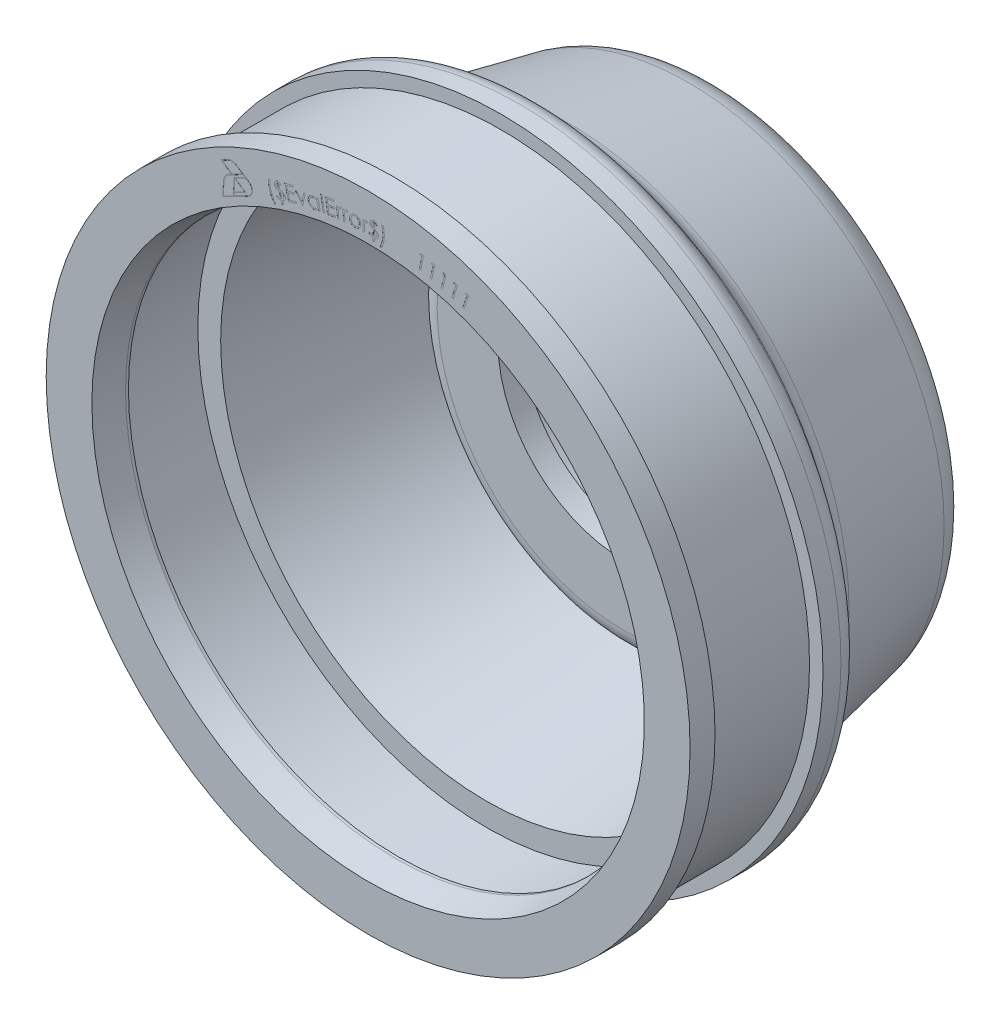
from build123d import *

# Parameters (mm, degrees)
CUT_EXTRUDE1_START = -0.01
CUT_EXTRUDE1_DEPTH = 0.01


# Read off the part's stored shape, not the designer's step: Cut-Extrude1
with BuildPart() as part:
    # Sketch1 → Revolve1 (revolve)
    with BuildSketch(Plane(origin=(0, 0, 0), x_dir=(0, 0, -1), z_dir=(1, 0, 0)), mode=Mode.PRIVATE) as revolve1_sk:
        with BuildLine():
            Line((0, 30.25), (0, 51.84306193))
            ThreePointArc((0, 51.84306193), (-2.250986696, 58.163884092), (-7.990558563, 61.639088936))
            Line((-7.990558563, 61.639088936), (-36.787849556, 67.54622555))
            ThreePointArc((-36.787849556, 67.54622555), (-38.780943256, 68.347628238), (-40.364003311, 69.799726591))
            Line((-40.364003311, 69.799726591), (-44.699441155, 75.520095969))
            ThreePointArc((-44.699441155, 75.520095969), (-46.459484376, 76.977749426), (-48.684290003, 77.5))
            Line((-48.684290003, 77.5), (-53, 77.5))
            Line((-53, 77.5), (-53, 74.25))
            Line((-53, 74.25), (-79, 74.25))
            Line((-79, 74.25), (-79, 77.5))
            Line((-79, 77.5), (-85, 77.5))
            Line((-85, 77.5), (-85, 66.5))
            Line((-85, 66.5), (-78.4, 65))
            Line((-78.4, 65), (-77.7, 65))
            Line((-77.7, 65), (-77.7, 69.5))
            Line((-77.7, 69.5), (-56.5, 69.5))
            Line((-56.5, 69.5), (-56.5, 64))
            Line((-56.5, 64), (-11.652067248, 57.697034096))
            ThreePointArc((-11.652067248, 57.697034096), (-10.113226049, 56.861511497), (-9.5, 55.221363924))
            Line((-9.5, 55.221363924), (-9.5, 54.006983458))
            ThreePointArc((-9.5, 54.006983458), (-10.050487257, 52.441927527), (-11.459520052, 51.566106274))
            Line((-11.459520052, 51.566106274), (-19.580959896, 49.767787452))
            ThreePointArc((-19.580959896, 49.767787452), (-22.399025486, 48.016144945), (-23.5, 44.886033084))
            Line((-23.5, 44.886033084), (-23.5, 30.25))
            Line((-23.5, 30.25), (-18, 30.25))
            Line((-18, 30.25), (-18, 37.65))
            ThreePointArc((-18, 37.65), (-17.912132034, 37.862132034), (-17.7, 37.95))
            Line((-17.7, 37.95), (-5.8, 37.95))
            ThreePointArc((-5.8, 37.95), (-5.587867966, 37.862132034), (-5.5, 37.65))
            Line((-5.5, 37.65), (-5.5, 30.25))
            Line((-5.5, 30.25), (0, 30.25))
        make_face()
    revolve(revolve1_sk.sketch.rotate(Axis((0, 0, 0), (0, 0, 1)), 90), axis=Axis((0, 0, 0), (0, 0, 1)))

    # Cut-Extrude1 outline → Cut-Extrude1 (cut)
    # profile 1 of 19: a face of its own
    with BuildSketch(Plane.XY.offset(85).offset(CUT_EXTRUDE1_START)):
        with BuildLine():
            add(Edge.make_bspline(
                [(-23.610921997, 65.482463356), (-23.646585557, 65.587061176), (-23.717480833, 65.794990259), (-23.804318716, 66.111448338), (-23.877281591, 66.428226101), (-23.93217108, 66.74545329), (-23.971585058, 67.059661744), (-23.994329579, 67.369011415), (-23.999947379, 67.671970761), (-23.990159236, 67.871444986), (-23.985321036, 67.970043484)],
                knots=[0, 0, 0, 0, 0.130878881, 0.260172971, 0.38851157, 0.515811978, 0.64135007, 0.763480574, 0.883090358, 1, 1, 1, 1], degree=3))
            add(Edge.make_bspline(
                [(-22.516470876, 63.552976177), (-22.567955957, 63.612414584), (-22.674116049, 63.734974104), (-22.823184373, 63.936953489), (-22.972124251, 64.157634656), (-23.116442262, 64.397880172), (-23.256537988, 64.65228781), (-23.384351951, 64.920186159), (-23.505909411, 65.196224544), (-23.575706384, 65.386474146), (-23.610921997, 65.482463356)],
                knots=[0, 0, 0, 0, 0.10569616, 0.217941078, 0.337254941, 0.463575966, 0.594637326, 0.727591538, 0.862558066, 1, 1, 1, 1], degree=3))
            Line((-22.516470876, 63.552976177), (-22.172220074, 63.674971369))
            add(Edge.make_bspline(
                [(-23.292612703, 65.643020247), (-23.256830908, 65.545906971), (-23.185936109, 65.353495547), (-23.064294309, 65.073009377), (-22.932925118, 64.802066194), (-22.791903737, 64.542486914), (-22.644495427, 64.29745215), (-22.491638026, 64.07115296), (-22.336455119, 63.863430896), (-22.226046215, 63.736736804), (-22.172220074, 63.674971369)],
                knots=[0, 0, 0, 0, 0.13626151, 0.269976179, 0.40238404, 0.532655648, 0.658849237, 0.778773484, 0.892148467, 1, 1, 1, 1], degree=3))
            add(Edge.make_bspline(
                [(-23.622841068, 68.099049895), (-23.627337339, 68.054437393), (-23.636435834, 67.964161132), (-23.644847596, 67.826652174), (-23.647827538, 67.685641105), (-23.648249083, 67.540920507), (-23.643267607, 67.392427527), (-23.632941409, 67.240300928), (-23.62003635, 67.084294208), (-23.595418613, 66.87120521), (-23.554364843, 66.602349767), (-23.485705566, 66.280660545), (-23.400310589, 65.959679752), (-23.328650304, 65.748980071), (-23.292612703, 65.643020247)],
                knots=[0, 0, 0, 0, 0.053847414, 0.108963702, 0.165397831, 0.223217908, 0.282754492, 0.343788676, 0.406327426, 0.470737215, 0.601378898, 0.732781804, 0.865617294, 1, 1, 1, 1], degree=3))
            Line((-23.622841068, 68.099049895), (-23.985321036, 67.970043484))
        make_face()
    # profile 2 of 19: a face of its own
    with BuildSketch(Plane.XY.offset(85).offset(CUT_EXTRUDE1_START)):
        with BuildLine():
            add(Edge.make_bspline(
                [(-21.684301012, 68.548223833), (-21.64625284, 68.552237072), (-21.57215586, 68.560052662), (-21.462901305, 68.559146188), (-21.359249167, 68.548211197), (-21.259403086, 68.526157597), (-21.161495749, 68.491365366), (-21.06178099, 68.445691949), (-20.961023894, 68.385429621), (-20.895205967, 68.338373125), (-20.861184024, 68.314049154)],
                knots=[0, 0, 0, 0, 0.130214002, 0.25358549, 0.371277994, 0.484630063, 0.600922819, 0.724499532, 0.857591061, 1, 1, 1, 1], degree=3))
            Line((-21.684301012, 68.548223833), (-21.762826653, 68.794317583))
            Line((-21.762826653, 68.794317583), (-22.05870005, 68.699666141))
            Line((-22.05870005, 68.699666141), (-21.98438114, 68.467594827))
            add(Edge.make_bspline(
                [(-22.557197646, 67.409602038), (-22.566596824, 67.443287588), (-22.585173599, 67.509864574), (-22.595673375, 67.612904921), (-22.593984948, 67.71615036), (-22.577268175, 67.818985992), (-22.549163736, 67.919841738), (-22.506955203, 68.015404387), (-22.454852042, 68.10651163), (-22.389605209, 68.191802254), (-22.311251802, 68.272122803), (-22.216241068, 68.344338477), (-22.106745299, 68.4111296), (-22.026169865, 68.448311322), (-21.98438114, 68.467594827)],
                knots=[0, 0, 0, 0, 0.078882619, 0.155905633, 0.233008232, 0.311566824, 0.390618893, 0.468891302, 0.546955082, 0.627211077, 0.710843528, 0.79966181, 0.896098885, 1, 1, 1, 1], degree=3))
            add(Edge.make_bspline(
                [(-21.96895646, 66.869037134), (-22.006165789, 66.881139456), (-22.07840412, 66.904634949), (-22.178710352, 66.951123161), (-22.268544699, 67.004568434), (-22.347081011, 67.066765566), (-22.415832288, 67.137821071), (-22.473133731, 67.219265077), (-22.521845566, 67.310077127), (-22.545197687, 67.375819164), (-22.557197646, 67.409602038)],
                knots=[0, 0, 0, 0, 0.140397712, 0.272568645, 0.39605397, 0.514927709, 0.631259345, 0.749788968, 0.871424006, 1, 1, 1, 1], degree=3))
            add(Edge.make_bspline(
                [(-21.444517358, 66.775086814), (-21.477006931, 66.779965376), (-21.539209869, 66.78930563), (-21.627828588, 66.803081682), (-21.707199088, 66.81671608), (-21.777402685, 66.828351152), (-21.838400537, 66.839600795), (-21.890124965, 66.849830089), (-21.932572584, 66.859852766), (-21.957745044, 66.866207041), (-21.96895646, 66.869037134)],
                knots=[0, 0, 0, 0, 0.184917582, 0.354034109, 0.50476252, 0.638191247, 0.754551574, 0.853871933, 0.934916865, 1, 1, 1, 1], degree=3))
            Line((-21.444517358, 66.775086814), (-20.999305018, 65.377751077))
            add(Edge.make_bspline(
                [(-21.940911589, 65.587386493), (-21.904001324, 65.56250827), (-21.831522193, 65.513655949), (-21.716523295, 65.455432216), (-21.60110539, 65.407819929), (-21.483224467, 65.375885181), (-21.364136909, 65.35603294), (-21.243319217, 65.348734648), (-21.120977237, 65.355709295), (-21.040087842, 65.37036298), (-20.999305018, 65.377751077)],
                knots=[0, 0, 0, 0, 0.13421557, 0.263553463, 0.388244014, 0.510421575, 0.631247935, 0.75206606, 0.874996639, 1, 1, 1, 1], degree=3))
            Line((-21.940911589, 65.587386493), (-22.123904377, 65.327270308))
            add(Edge.make_bspline(
                [(-20.899745723, 65.066453), (-20.94497755, 65.056526821), (-21.031061129, 65.037635675), (-21.155464861, 65.019653535), (-21.267864967, 65.009346745), (-21.370728458, 65.0107861), (-21.468356442, 65.021641112), (-21.564977126, 65.041864428), (-21.663642488, 65.068928743), (-21.762341467, 65.105591275), (-21.860034419, 65.148982194), (-21.953241473, 65.201074266), (-22.041685857, 65.26016336), (-22.096435077, 65.304849801), (-22.123904377, 65.327270308)],
                knots=[0, 0, 0, 0, 0.106398446, 0.202493678, 0.288720367, 0.365539859, 0.438500915, 0.514137581, 0.592201466, 0.673429701, 0.755893531, 0.837647544, 0.91854298, 1, 1, 1, 1], degree=3))
            Line((-20.899745723, 65.066453), (-20.674685627, 64.360423352))
            Line((-20.674685627, 64.360423352), (-20.37881223, 64.455074795))
            Line((-20.37881223, 64.455074795), (-20.603872326, 65.161104442))
            add(Edge.make_bspline(
                [(-20.223163191, 65.401589218), (-20.246567713, 65.380704207), (-20.296460383, 65.336182513), (-20.385519587, 65.277149881), (-20.488300075, 65.216331345), (-20.564053027, 65.180132336), (-20.603872326, 65.161104442)],
                knots=[0, 0, 0, 0, 0.207907199, 0.443206877, 0.707323463, 1, 1, 1, 1], degree=3))
            add(Edge.make_bspline(
                [(-19.965851492, 66.338989058), (-19.95456914, 66.297877512), (-19.932211213, 66.216407896), (-19.920508793, 66.090204251), (-19.928594141, 65.964060796), (-19.954933906, 65.83941466), (-19.997041776, 65.718263855), (-20.057465666, 65.604348264), (-20.131227538, 65.496566731), (-20.192280065, 65.433494169), (-20.223163191, 65.401589218)],
                knots=[0, 0, 0, 0, 0.124661529, 0.247038316, 0.369093168, 0.493519641, 0.619064775, 0.743348116, 0.870173883, 1, 1, 1, 1], degree=3))
            add(Edge.make_bspline(
                [(-20.325526973, 66.82837207), (-20.304232428, 66.812334701), (-20.262045172, 66.780562592), (-20.203821829, 66.727623706), (-20.150583389, 66.671662988), (-20.102219666, 66.612470907), (-20.060333167, 66.548975011), (-20.02313878, 66.482501829), (-19.991051683, 66.412431759), (-19.97432535, 66.36368502), (-19.965851492, 66.338989058)],
                knots=[0, 0, 0, 0, 0.129320662, 0.256200998, 0.381356102, 0.503935551, 0.626619903, 0.750004807, 0.873347999, 1, 1, 1, 1], degree=3))
            add(Edge.make_bspline(
                [(-21.222261749, 67.099706205), (-21.167270249, 67.089775024), (-21.061932421, 67.070751556), (-20.912068284, 67.037934187), (-20.776802318, 67.006661318), (-20.65715923, 66.972766404), (-20.552464684, 66.938705711), (-20.462465307, 66.904169598), (-20.387527548, 66.868456582), (-20.344931829, 66.840917667), (-20.325526973, 66.82837207)],
                knots=[0, 0, 0, 0, 0.177869218, 0.340713697, 0.488320378, 0.619738732, 0.736429391, 0.838663987, 0.926501953, 1, 1, 1, 1], degree=3))
            Line((-21.222261749, 67.099706205), (-21.581236108, 68.225707808))
            add(Edge.make_bspline(
                [(-21.042073448, 68.039910532), (-21.06352233, 68.056896946), (-21.105414151, 68.090073117), (-21.171703251, 68.13216325), (-21.23847117, 68.166956661), (-21.306053911, 68.193440007), (-21.37395683, 68.213735482), (-21.442671286, 68.225469012), (-21.512052767, 68.229970045), (-21.55810517, 68.227132855), (-21.581236108, 68.225707808)],
                knots=[0, 0, 0, 0, 0.140059684, 0.273550619, 0.401505992, 0.525097896, 0.644802655, 0.763865272, 0.881395596, 1, 1, 1, 1], degree=3))
            Line((-21.042073448, 68.039910532), (-20.861184024, 68.314049154))
        make_face()
        with BuildLine():
            add(Edge.make_bspline(
                [(-20.283459665, 66.230315179), (-20.295268584, 66.261656396), (-20.318763353, 66.324012205), (-20.372902875, 66.409230308), (-20.440988825, 66.485759358), (-20.509610058, 66.541223422), (-20.57307723, 66.581153294), (-20.628246628, 66.610512022), (-20.691235519, 66.637654835), (-20.761144842, 66.663627864), (-20.838667447, 66.68690197), (-20.922621949, 66.710419183), (-21.014184682, 66.73124208), (-21.077793091, 66.74349269), (-21.110783383, 66.749846429)],
                knots=[0, 0, 0, 0, 0.097265612, 0.193517564, 0.291802856, 0.394313768, 0.449037548, 0.509893625, 0.575986598, 0.648511043, 0.726823263, 0.811474825, 0.902222036, 1, 1, 1, 1], degree=3))
            add(Edge.make_bspline(
                [(-20.706236108, 65.481517102), (-20.685077361, 65.492262195), (-20.643726056, 65.513261718), (-20.58493572, 65.548225149), (-20.531867234, 65.587247911), (-20.482335432, 65.627596339), (-20.438043678, 65.67150609), (-20.397860787, 65.717674575), (-20.362616434, 65.766961128), (-20.332826875, 65.818617638), (-20.30766832, 65.871174169), (-20.286883823, 65.923444164), (-20.273043447, 65.976017787), (-20.263651432, 66.027804741), (-20.260008233, 66.079319819), (-20.262517045, 66.130234612), (-20.268785261, 66.181025262), (-20.278550225, 66.21382484), (-20.283459665, 66.230315179)],
                knots=[0, 0, 0, 0, 0.075931283, 0.148395256, 0.218553462, 0.286537605, 0.352640637, 0.417857826, 0.482190015, 0.546195366, 0.608410623, 0.668546038, 0.725872266, 0.782060378, 0.836781079, 0.890672748, 0.945034554, 1, 1, 1, 1], degree=3))
            Line((-20.706236108, 65.481517102), (-21.110783383, 66.749846429))
        make_face(mode=Mode.SUBTRACT)
        with BuildLine():
            add(Edge.make_bspline(
                [(-22.047482101, 67.276388897), (-22.015686965, 67.258138141), (-21.948814302, 67.219752501), (-21.833024772, 67.178960098), (-21.700953436, 67.146880813), (-21.606404695, 67.13388326), (-21.556696845, 67.127049955)],
                knots=[0, 0, 0, 0, 0.212340362, 0.446601818, 0.709057638, 1, 1, 1, 1], degree=3))
            add(Edge.make_bspline(
                [(-22.229773768, 67.521080404), (-22.220327862, 67.495453148), (-22.201866405, 67.445366214), (-22.160562725, 67.378154431), (-22.109563694, 67.320308612), (-22.068225566, 67.291063892), (-22.047482101, 67.276388897)],
                knots=[0, 0, 0, 0, 0.262678826, 0.513390028, 0.755819205, 1, 1, 1, 1], degree=3))
            add(Edge.make_bspline(
                [(-21.884120723, 68.153492263), (-21.910116803, 68.142382726), (-21.960024012, 68.121054667), (-22.027207827, 68.081228893), (-22.085954428, 68.039752723), (-22.13313887, 67.992501091), (-22.172569247, 67.943015176), (-22.203579191, 67.889415657), (-22.228501535, 67.832656644), (-22.244963457, 67.772188263), (-22.254677508, 67.710009313), (-22.253702005, 67.646891381), (-22.247794665, 67.583249922), (-22.235831569, 67.54197895), (-22.229773768, 67.521080404)],
                knots=[0, 0, 0, 0, 0.10566569, 0.202856725, 0.291711662, 0.37395609, 0.451805836, 0.527846724, 0.60501073, 0.683090983, 0.761746977, 0.839577074, 0.918766007, 1, 1, 1, 1], degree=3))
            Line((-21.884120723, 68.153492263), (-21.556696845, 67.127049955))
        make_face(mode=Mode.SUBTRACT)
    # profile 3 of 19: a face of its own
    with BuildSketch(Plane.XY.offset(85).offset(CUT_EXTRUDE1_START)):
        with BuildLine():
            add(Edge.make_bspline(
                [(-11.954860286, 67.823389198), (-11.981747014, 67.777217502), (-12.03426793, 67.687025058), (-12.127385647, 67.564048481), (-12.228876917, 67.454653392), (-12.340583807, 67.360408181), (-12.460144672, 67.279227978), (-12.590089519, 67.215183561), (-12.727793011, 67.162400609), (-12.824829132, 67.141352988), (-12.874030959, 67.130680865)],
                knots=[0, 0, 0, 0, 0.134420733, 0.262579365, 0.387471949, 0.509376274, 0.629817602, 0.750340833, 0.873411191, 1, 1, 1, 1], degree=3))
            Line((-11.954860286, 67.823389198), (-11.872127914, 67.389394807))
            Line((-11.872127914, 67.389394807), (-11.551014132, 67.450392403))
            Line((-11.551014132, 67.450392403), (-12.032684805, 69.977235352))
            Line((-12.032684805, 69.977235352), (-12.353798587, 69.916237756))
            Line((-12.353798587, 69.916237756), (-12.265457241, 69.452095127))
            add(Edge.make_bspline(
                [(-13.371827433, 69.789334711), (-13.320779287, 69.797619357), (-13.220532287, 69.813888526), (-13.070155364, 69.816158485), (-12.924100296, 69.800928486), (-12.782362161, 69.766817267), (-12.644805479, 69.715335727), (-12.512074896, 69.645851805), (-12.383920053, 69.558369047), (-12.305588318, 69.488097032), (-12.265457241, 69.452095127)],
                knots=[0, 0, 0, 0, 0.128662651, 0.252664307, 0.373251497, 0.493536278, 0.614731614, 0.738134837, 0.865840698, 1, 1, 1, 1], degree=3))
            add(Edge.make_bspline(
                [(-14.424912369, 68.21882189), (-14.43231735, 68.263823534), (-14.446908749, 68.352498571), (-14.453666649, 68.485706356), (-14.447693589, 68.616125433), (-14.42739904, 68.743734209), (-14.396219785, 68.869151544), (-14.350902139, 68.99176618), (-14.292203726, 69.1112824), (-14.221733919, 69.226920527), (-14.141574124, 69.335654654), (-14.05319416, 69.434809483), (-13.95790214, 69.523157133), (-13.853948089, 69.598619601), (-13.744413534, 69.664810167), (-13.626716516, 69.717804864), (-13.502588987, 69.7615755), (-13.415787636, 69.780002453), (-13.371827433, 69.789334711)],
                knots=[0, 0, 0, 0, 0.06503562, 0.128151674, 0.189918606, 0.250996618, 0.312223751, 0.37405007, 0.437137927, 0.50193714, 0.567034289, 0.62962307, 0.691223234, 0.752053115, 0.812619163, 0.873502953, 0.935936067, 1, 1, 1, 1], degree=3))
            add(Edge.make_bspline(
                [(-12.874030959, 67.130680865), (-12.918099101, 67.123509645), (-13.005150243, 67.109343791), (-13.136054602, 67.103284077), (-13.264566078, 67.110176917), (-13.390593619, 67.130509681), (-13.513801895, 67.164614255), (-13.634487276, 67.21095121), (-13.751936066, 67.271414665), (-13.866010347, 67.342792913), (-13.973219483, 67.425032437), (-14.071270046, 67.515526325), (-14.157961666, 67.614400026), (-14.233922245, 67.720488113), (-14.298989082, 67.834105249), (-14.352115372, 67.955546884), (-14.395426889, 68.08410524), (-14.414992089, 68.173496975), (-14.424912369, 68.21882189)],
                knots=[0, 0, 0, 0, 0.063491808, 0.125420183, 0.186037246, 0.246341512, 0.306688861, 0.367645243, 0.429962608, 0.494366707, 0.558886614, 0.621951969, 0.68392676, 0.745665543, 0.807332632, 0.869867905, 0.934018216, 1, 1, 1, 1], degree=3))
        make_face()
        with BuildLine():
            add(Edge.make_bspline(
                [(-12.08947567, 68.643000576), (-12.097262485, 68.678686546), (-12.112553003, 68.748761026), (-12.145918528, 68.849711797), (-12.187120719, 68.944359233), (-12.23657973, 69.033140391), (-12.294800655, 69.115047161), (-12.361445335, 69.190777507), (-12.435955274, 69.260189739), (-12.517524072, 69.323076014), (-12.604592354, 69.377216345), (-12.694817781, 69.422674393), (-12.787683046, 69.457710172), (-12.882945395, 69.483465334), (-12.980831335, 69.497935989), (-13.080835728, 69.502702051), (-13.183343543, 69.498272122), (-13.251556211, 69.486722347), (-13.286290574, 69.480841121)],
                knots=[0, 0, 0, 0, 0.067164547, 0.131887149, 0.195235465, 0.256836323, 0.318516663, 0.379756311, 0.442120759, 0.505590076, 0.56894277, 0.630476063, 0.691168342, 0.751243678, 0.811688712, 0.87281958, 0.935238847, 1, 1, 1, 1], degree=3))
            add(Edge.make_bspline(
                [(-12.898570222, 67.434266602), (-12.854741318, 67.444283703), (-12.767611089, 67.464197328), (-12.643154536, 67.515486223), (-12.525270241, 67.581654214), (-12.415713859, 67.663469234), (-12.31768875, 67.7579034), (-12.233494709, 67.86259837), (-12.166680832, 67.977129881), (-12.115755896, 68.09995949), (-12.082307321, 68.229569219), (-12.066228343, 68.364370948), (-12.067121165, 68.503313179), (-12.08194053, 68.595915474), (-12.08947567, 68.643000576)],
                knots=[0, 0, 0, 0, 0.083016399, 0.165033511, 0.247852821, 0.332471343, 0.417132893, 0.498934529, 0.580095509, 0.661475956, 0.744073969, 0.826784963, 0.911926074, 1, 1, 1, 1], degree=3))
            add(Edge.make_bspline(
                [(-14.094684004, 68.270003781), (-14.084638588, 68.226185658), (-14.064620158, 68.138865233), (-14.013419504, 68.0135772), (-13.946442739, 67.894311755), (-13.863373991, 67.782971813), (-13.767588105, 67.682806954), (-13.661314964, 67.596620228), (-13.545356934, 67.526796626), (-13.421518381, 67.473098137), (-13.292655542, 67.435560026), (-13.161496819, 67.416884111), (-13.029285636, 67.414516391), (-12.942403615, 67.427643674), (-12.898570222, 67.434266602)],
                knots=[0, 0, 0, 0, 0.083241212, 0.165882458, 0.249893867, 0.336301848, 0.422730472, 0.506243072, 0.589254999, 0.672899034, 0.755874759, 0.837320109, 0.917925346, 1, 1, 1, 1], degree=3))
            add(Edge.make_bspline(
                [(-13.286290574, 69.480841121), (-13.330570708, 69.470797831), (-13.418076336, 69.450950458), (-13.542610232, 69.400815427), (-13.658722598, 69.33515943), (-13.764681492, 69.253802473), (-13.860073347, 69.159830655), (-13.940853911, 69.053011679), (-14.008490645, 68.9354916), (-14.059400648, 68.807838328), (-14.095232571, 68.674853327), (-14.113555207, 68.539659752), (-14.115163608, 68.403949152), (-14.101528125, 68.31476726), (-14.094684004, 68.270003781)],
                knots=[0, 0, 0, 0, 0.084075912, 0.166149353, 0.247843302, 0.330695441, 0.413117017, 0.495361856, 0.578237787, 0.663771627, 0.749433788, 0.832959647, 0.916156664, 1, 1, 1, 1], degree=3))
        make_face(mode=Mode.SUBTRACT)
    # profile 4 of 19: a face of its own
    with BuildSketch(Plane.XY.offset(85).offset(CUT_EXTRUDE1_START)):
        with BuildLine():
            add(Edge.make_bspline(
                [(-7.257637229, 70.251939464), (-7.236582628, 70.289288569), (-7.195930378, 70.36140227), (-7.126214864, 70.458737952), (-7.054120293, 70.54323421), (-6.977899265, 70.613506382), (-6.898081225, 70.670008467), (-6.815572902, 70.714429421), (-6.728902685, 70.744828619), (-6.669135756, 70.753708695), (-6.639247806, 70.7581494)],
                knots=[0, 0, 0, 0, 0.15447592, 0.298262301, 0.430870432, 0.554315175, 0.670971121, 0.782537997, 0.891252675, 1, 1, 1, 1], degree=3))
            Line((-7.257637229, 70.251939464), (-7.295497806, 70.624936258))
            Line((-7.295497806, 70.624936258), (-7.631335146, 70.590581291))
            Line((-7.631335146, 70.590581291), (-7.372621203, 68.039900201))
            Line((-7.372621203, 68.039900201), (-7.036783864, 68.074255169))
            Line((-7.036783864, 68.074255169), (-7.124424088, 68.937336098))
            add(Edge.make_bspline(
                [(-7.153170082, 69.824255169), (-7.155984106, 69.803246535), (-7.162188021, 69.756930025), (-7.166546752, 69.68035318), (-7.167789099, 69.590074178), (-7.165239676, 69.486044018), (-7.160476904, 69.368215342), (-7.151780504, 69.236860559), (-7.139871163, 69.091708624), (-7.129731089, 68.990372367), (-7.124424088, 68.937336098)],
                knots=[0, 0, 0, 0, 0.071493073, 0.157616612, 0.258556919, 0.376067216, 0.508650139, 0.656402902, 0.820171883, 1, 1, 1, 1], degree=3))
            add(Edge.make_bspline(
                [(-6.660982582, 70.433530008), (-6.688192287, 70.429102375), (-6.743199773, 70.420151416), (-6.821474051, 70.384127052), (-6.897006178, 70.333811029), (-6.954384374, 70.27781451), (-6.998631966, 70.226329649), (-7.028514705, 70.181389822), (-7.056940733, 70.133299901), (-7.081206169, 70.079925634), (-7.103863191, 70.022480556), (-7.123045877, 69.960275558), (-7.140250089, 69.893886527), (-7.148778892, 69.847921168), (-7.153170082, 69.824255169)],
                knots=[0, 0, 0, 0, 0.097976807, 0.198071156, 0.304474478, 0.420688644, 0.482837314, 0.546451631, 0.612968332, 0.681994424, 0.755405707, 0.833218748, 0.914130008, 1, 1, 1, 1], degree=3))
            add(Edge.make_bspline(
                [(-6.482897646, 70.406186258), (-6.50011219, 70.41141134), (-6.532380808, 70.421205742), (-6.579565295, 70.430398197), (-6.621865903, 70.435213964), (-6.648589343, 70.434063532), (-6.660982582, 70.433530008)],
                knots=[0, 0, 0, 0, 0.297577697, 0.557808611, 0.794929706, 1, 1, 1, 1], degree=3))
            Line((-6.482897646, 70.406186258), (-6.3398688, 70.700657412))
            add(Edge.make_bspline(
                [(-6.639247806, 70.7581494), (-6.616091313, 70.759318083), (-6.568192431, 70.761735489), (-6.494362929, 70.751533899), (-6.417140451, 70.731883954), (-6.366298559, 70.711338043), (-6.3398688, 70.700657412)],
                knots=[0, 0, 0, 0, 0.225455396, 0.46635134, 0.722586919, 1, 1, 1, 1], degree=3))
        make_face()
    # profile 5 of 19: a face of its own
    with BuildSketch(Plane.XY.offset(85).offset(CUT_EXTRUDE1_START)):
        with BuildLine():
            add(Edge.make_bspline(
                [(-5.732326998, 70.407704248), (-5.710082384, 70.445059466), (-5.667402598, 70.516731319), (-5.595142205, 70.613546035), (-5.520342221, 70.697055477), (-5.441549288, 70.766383152), (-5.359535269, 70.821823073), (-5.27499408, 70.863653847), (-5.187310251, 70.892260266), (-5.127217326, 70.899680037), (-5.097110652, 70.903397357)],
                knots=[0, 0, 0, 0, 0.155334633, 0.29803389, 0.431115203, 0.555451642, 0.672238359, 0.783957366, 0.891762213, 1, 1, 1, 1], degree=3))
            Line((-5.732326998, 70.407704248), (-5.761774113, 70.784206652))
            Line((-5.761774113, 70.784206652), (-6.099714819, 70.757564024))
            Line((-6.099714819, 70.757564024), (-5.89709062, 68.183044793))
            Line((-5.89709062, 68.183044793), (-5.559149915, 68.209687421))
            Line((-5.559149915, 68.209687421), (-5.627859851, 69.08048069))
            add(Edge.make_bspline(
                [(-5.636273312, 69.975112101), (-5.63987405, 69.954119525), (-5.647837922, 69.907689543), (-5.653002615, 69.830282997), (-5.656792403, 69.739344278), (-5.655950811, 69.634354091), (-5.654374217, 69.515593744), (-5.648144131, 69.382850473), (-5.640051943, 69.236268453), (-5.632047187, 69.133985514), (-5.627859851, 69.08048069)],
                knots=[0, 0, 0, 0, 0.071229555, 0.15754079, 0.25928043, 0.375803556, 0.508770104, 0.656706955, 0.820421333, 1, 1, 1, 1], degree=3))
            add(Edge.make_bspline(
                [(-5.125856645, 70.577375722), (-5.153250457, 70.573622998), (-5.208692585, 70.566027888), (-5.288856715, 70.532407263), (-5.365699216, 70.482580744), (-5.425301865, 70.428063712), (-5.470640709, 70.376936544), (-5.501863119, 70.332328534), (-5.531468632, 70.284025164), (-5.558222275, 70.231048208), (-5.5818375, 70.173537546), (-5.602988932, 70.111509579), (-5.620985019, 70.044898091), (-5.631092319, 69.998761618), (-5.636273312, 69.975112101)],
                knots=[0, 0, 0, 0, 0.097520897, 0.197371808, 0.304535107, 0.42050374, 0.482060311, 0.54610683, 0.612930052, 0.682483098, 0.755917619, 0.832829696, 0.914308643, 1, 1, 1, 1], degree=3))
            add(Edge.make_bspline(
                [(-4.947070588, 70.545825242), (-4.964280203, 70.551498443), (-4.996737699, 70.562198153), (-5.04388828, 70.572826927), (-5.086462777, 70.578319038), (-5.113224929, 70.577678198), (-5.125856645, 70.577375722)],
                knots=[0, 0, 0, 0, 0.297408234, 0.560914696, 0.792752051, 1, 1, 1, 1], degree=3))
            Line((-4.947070588, 70.545825242), (-4.797030524, 70.838894152))
            add(Edge.make_bspline(
                [(-5.097110652, 70.903397357), (-5.0737099, 70.904087251), (-5.025488903, 70.905508887), (-4.951342411, 70.894090699), (-4.874233389, 70.872042269), (-4.823453215, 70.850239099), (-4.797030524, 70.838894152)],
                knots=[0, 0, 0, 0, 0.226080952, 0.465876012, 0.722076708, 1, 1, 1, 1], degree=3))
        make_face()
    # profile 6 of 19: a face of its own
    with BuildSketch(Plane.XY.offset(85).offset(CUT_EXTRUDE1_START)):
        with BuildLine():
            add(Edge.make_bspline(
                [(-4.165237014, 70.516135107), (-4.133955069, 70.552129927), (-4.0721441, 70.623253215), (-3.96789539, 70.716303563), (-3.856793825, 70.79654515), (-3.738707062, 70.863209898), (-3.613508473, 70.917170017), (-3.481245994, 70.956729845), (-3.341972417, 70.984204299), (-3.246423884, 70.990890066), (-3.197688937, 70.994300171)],
                knots=[0, 0, 0, 0, 0.128402199, 0.253713908, 0.375535069, 0.497080814, 0.618391391, 0.742110481, 0.868462323, 1, 1, 1, 1], degree=3))
            add(Edge.make_bspline(
                [(-4.477937334, 69.572425171), (-4.479073824, 69.616385874), (-4.481314761, 69.70306781), (-4.469007535, 69.831356609), (-4.448022793, 69.955948115), (-4.413922701, 70.076319604), (-4.368777586, 70.192723195), (-4.312444867, 70.305139607), (-4.244991744, 70.413965527), (-4.192058305, 70.481775765), (-4.165237014, 70.516135107)],
                knots=[0, 0, 0, 0, 0.129501371, 0.255351464, 0.379129731, 0.501471749, 0.62337862, 0.746599801, 0.87160251, 1, 1, 1, 1], degree=3))
            add(Edge.make_bspline(
                [(-3.074992623, 68.287268921), (-3.123394619, 68.286327773), (-3.218052235, 68.284487211), (-3.357281248, 68.297702584), (-3.490403015, 68.322421891), (-3.617247751, 68.361364341), (-3.73818172, 68.41281084), (-3.852722869, 68.477465308), (-3.960676926, 68.55553025), (-4.061559976, 68.644630066), (-4.153239067, 68.742999548), (-4.235109105, 68.846836505), (-4.305056433, 68.955960161), (-4.362319397, 69.070271635), (-4.410229752, 69.188606162), (-4.44488594, 69.312318878), (-4.468591287, 69.440744033), (-4.47479552, 69.528158576), (-4.477937334, 69.572425171)],
                knots=[0, 0, 0, 0, 0.068415575, 0.133797275, 0.197386751, 0.259593795, 0.321045555, 0.382907462, 0.445188215, 0.509113502, 0.572949868, 0.635099816, 0.695886711, 0.755897721, 0.815676195, 0.876147789, 0.937281423, 1, 1, 1, 1], degree=3))
            add(Edge.make_bspline(
                [(-1.796847591, 69.694420364), (-1.796056104, 69.649999881), (-1.794495234, 69.562399336), (-1.805920342, 69.432251795), (-1.829648339, 69.306136225), (-1.865878851, 69.183628271), (-1.913693089, 69.06515991), (-1.972850617, 68.949862337), (-2.045007315, 68.838959013), (-2.127567286, 68.73274988), (-2.219181671, 68.633908571), (-2.320181232, 68.547393998), (-2.428079482, 68.472358776), (-2.543496763, 68.409769071), (-2.666234554, 68.359675228), (-2.796095333, 68.322878345), (-2.932894649, 68.296789581), (-3.026967215, 68.290486656), (-3.074992623, 68.287268921)],
                knots=[0, 0, 0, 0, 0.062858303, 0.123961319, 0.184564322, 0.244233641, 0.304500695, 0.365165974, 0.427383724, 0.49150906, 0.555407841, 0.617810029, 0.679388562, 0.741119762, 0.803292638, 0.866640928, 0.931918262, 1, 1, 1, 1], degree=3))
            add(Edge.make_bspline(
                [(-2.193682526, 70.607982062), (-2.163872265, 70.576247067), (-2.104923109, 70.51349179), (-2.027761431, 70.41127404), (-1.961376276, 70.3043402), (-1.906357242, 70.192005148), (-1.862331655, 70.074760462), (-1.828334038, 69.952627164), (-1.805516046, 69.825361089), (-1.799762165, 69.738446262), (-1.796847591, 69.694420364)],
                knots=[0, 0, 0, 0, 0.128011343, 0.253139699, 0.376009528, 0.497768351, 0.620480356, 0.743912468, 0.870281238, 1, 1, 1, 1], degree=3))
            add(Edge.make_bspline(
                [(-3.197688937, 70.994300171), (-3.14904767, 70.99534624), (-3.053635369, 70.997398155), (-2.91315008, 70.982586387), (-2.778206622, 70.955452734), (-2.648883904, 70.914294622), (-2.525827261, 70.857909423), (-2.408194741, 70.788916374), (-2.29577976, 70.706196107), (-2.228042025, 70.641034724), (-2.193682526, 70.607982062)],
                knots=[0, 0, 0, 0, 0.131419109, 0.257785216, 0.380953363, 0.50303909, 0.623776743, 0.74611725, 0.871219728, 1, 1, 1, 1], degree=3))
        make_face()
        with BuildLine():
            add(Edge.make_bspline(
                [(-2.13268493, 69.671984466), (-2.134963617, 69.707364873), (-2.139459857, 69.777176459), (-2.159237438, 69.878899201), (-2.186241936, 69.976822393), (-2.223737347, 70.069852205), (-2.26929331, 70.158871796), (-2.324735811, 70.243081151), (-2.389254008, 70.322729249), (-2.461756711, 70.397390551), (-2.540424297, 70.464555689), (-2.6223182, 70.524357717), (-2.708608075, 70.572540957), (-2.797309911, 70.612473902), (-2.889548901, 70.641900797), (-2.984705151, 70.661515315), (-3.082950055, 70.671807125), (-3.149292017, 70.670396682), (-3.182965379, 70.66968078)],
                knots=[0, 0, 0, 0, 0.06602305, 0.130274753, 0.192745895, 0.255115189, 0.316877553, 0.378860751, 0.442676804, 0.507678762, 0.572553598, 0.63529754, 0.696355333, 0.756421371, 0.816349819, 0.876411117, 0.937269669, 1, 1, 1, 1], degree=3))
            add(Edge.make_bspline(
                [(-3.089015058, 68.601371485), (-3.044222624, 68.605159125), (-2.955836009, 68.61263308), (-2.826887627, 68.643251903), (-2.704861682, 68.690904239), (-2.589444679, 68.753142702), (-2.483591401, 68.83086937), (-2.389669486, 68.92287374), (-2.308173852, 69.027755644), (-2.24088907, 69.144512512), (-2.187607783, 69.269470209), (-2.150820369, 69.400170927), (-2.131214265, 69.535124796), (-2.13219209, 69.626120934), (-2.13268493, 69.671984466)],
                knots=[0, 0, 0, 0, 0.084248044, 0.166242344, 0.247583442, 0.329394666, 0.411563446, 0.493106358, 0.575283326, 0.659959259, 0.745222287, 0.829478317, 0.9140543, 1, 1, 1, 1], degree=3))
            add(Edge.make_bspline(
                [(-4.139295507, 69.580838633), (-4.135648347, 69.535079119), (-4.128424491, 69.444444185), (-4.095435727, 69.312199534), (-4.047922184, 69.184979121), (-3.983309138, 69.065064154), (-3.905628447, 68.954629442), (-3.81495373, 68.857494743), (-3.713032683, 68.774704796), (-3.600813361, 68.706598091), (-3.480299069, 68.654893204), (-3.353937745, 68.619670631), (-3.222868633, 68.599808619), (-3.133950702, 68.60084682), (-3.089015058, 68.601371485)],
                knots=[0, 0, 0, 0, 0.085950947, 0.170241285, 0.254565794, 0.340048462, 0.424922351, 0.507088579, 0.588399546, 0.670397309, 0.752454776, 0.833480625, 0.915847623, 1, 1, 1, 1], degree=3))
            add(Edge.make_bspline(
                [(-3.182965379, 70.66968078), (-3.216713751, 70.66739972), (-3.283284045, 70.662900217), (-3.380631376, 70.643067899), (-3.474212513, 70.615630781), (-3.563208919, 70.576958703), (-3.648366286, 70.529997966), (-3.729579395, 70.473288352), (-3.806723728, 70.40741477), (-3.878183116, 70.332477469), (-3.943839223, 70.252273786), (-4.000046564, 70.166807869), (-4.047832798, 70.078169475), (-4.084303572, 69.985126104), (-4.114202421, 69.889322715), (-4.131563267, 69.789429054), (-4.141324955, 69.686202458), (-4.139980131, 69.616382567), (-4.139295507, 69.580838633)],
                knots=[0, 0, 0, 0, 0.062943317, 0.124158735, 0.184620301, 0.244297858, 0.304509715, 0.365495606, 0.428485574, 0.493141391, 0.55813925, 0.621286978, 0.683412027, 0.74533541, 0.80717304, 0.870018425, 0.933828935, 1, 1, 1, 1], degree=3))
        make_face(mode=Mode.SUBTRACT)
    # profile 7 of 19: a face of its own
    with BuildSketch(Plane.XY.offset(85).offset(CUT_EXTRUDE1_START)):
        with BuildLine():
            add(Edge.make_bspline(
                [(-0.898586153, 70.605332549), (-0.875397395, 70.640388377), (-0.831049074, 70.707432377), (-0.757336144, 70.796101678), (-0.681832813, 70.869516724), (-0.604177626, 70.928020243), (-0.523799526, 70.971833362), (-0.442462574, 71.003926397), (-0.358887104, 71.022903712), (-0.30272518, 71.025437371), (-0.274587756, 71.026706748)],
                knots=[0, 0, 0, 0, 0.160059412, 0.306112383, 0.438366514, 0.560541455, 0.675317225, 0.786113634, 0.892841788, 1, 1, 1, 1], degree=3))
            Line((-0.898586153, 70.605332549), (-0.898586153, 70.981834953))
            Line((-0.898586153, 70.981834953), (-1.212688717, 70.981834953))
            Line((-1.212688717, 70.981834953), (-1.212688717, 68.424142645))
            Line((-1.212688717, 68.424142645), (-0.898586153, 68.424142645))
            Line((-0.898586153, 68.424142645), (-0.898586153, 69.283717966))
            add(Edge.make_bspline(
                [(-0.84249641, 70.161522453), (-0.847228803, 70.141245279), (-0.857710695, 70.096332881), (-0.867902233, 70.020984356), (-0.877971751, 69.931960697), (-0.885068369, 69.829014104), (-0.891646411, 69.71240166), (-0.895356493, 69.581945715), (-0.898459634, 69.437512364), (-0.898542701, 69.33653801), (-0.898586153, 69.283717966)],
                knots=[0, 0, 0, 0, 0.070854869, 0.15693815, 0.258600395, 0.37589093, 0.508166168, 0.656237809, 0.82017677, 1, 1, 1, 1], degree=3))
            add(Edge.make_bspline(
                [(-0.334183108, 70.712604184), (-0.359388842, 70.710924146), (-0.410801232, 70.707497357), (-0.486285731, 70.680558549), (-0.559532937, 70.637033309), (-0.617704599, 70.588762197), (-0.662746852, 70.5422144), (-0.694887078, 70.501565997), (-0.724369825, 70.455987366), (-0.752540045, 70.406257682), (-0.778206339, 70.351527836), (-0.802161008, 70.292344622), (-0.823819871, 70.228639494), (-0.836170116, 70.184256973), (-0.84249641, 70.161522453)],
                knots=[0, 0, 0, 0, 0.093806529, 0.191338128, 0.295190617, 0.410312337, 0.471930251, 0.536425159, 0.603118728, 0.674117672, 0.749332023, 0.828283384, 0.912039809, 1, 1, 1, 1], degree=3))
            add(Edge.make_bspline(
                [(-0.173626217, 70.667031267), (-0.188735239, 70.673771533), (-0.217415053, 70.686565848), (-0.259369619, 70.701707859), (-0.298050956, 70.710623774), (-0.322694514, 70.711974492), (-0.334183108, 70.712604184)],
                knots=[0, 0, 0, 0, 0.295138801, 0.560229945, 0.794983357, 1, 1, 1, 1], degree=3))
            Line((-0.173626217, 70.667031267), (-0.001150256, 70.939066523))
            add(Edge.make_bspline(
                [(-0.274587756, 71.026706748), (-0.252761429, 71.025516221), (-0.207852344, 71.023066635), (-0.139869754, 71.005855811), (-0.069826303, 70.978377788), (-0.024683915, 70.952537565), (-0.001150256, 70.939066523)],
                knots=[0, 0, 0, 0, 0.225277548, 0.463523195, 0.720323555, 1, 1, 1, 1], degree=3))
        make_face()
    # profile 8 of 19: a face of its own
    with BuildSketch(Plane.XY.offset(85).offset(CUT_EXTRUDE1_START)):
        with BuildLine():
            add(Edge.make_bspline(
                [(1.585424735, 71.87637028), (1.622759983, 71.86792515), (1.69528933, 71.851519211), (1.798669774, 71.816366953), (1.892923293, 71.771922111), (1.980397408, 71.719199314), (2.062496671, 71.655444718), (2.140825245, 71.579004748), (2.217817101, 71.490126911), (2.264891, 71.424099951), (2.289351017, 71.389791754)],
                knots=[0, 0, 0, 0, 0.130281342, 0.253091145, 0.370924549, 0.484474646, 0.600195795, 0.724012168, 0.856594266, 1, 1, 1, 1], degree=3))
            Line((1.585424735, 71.87637028), (1.590332587, 72.1343831))
            Line((1.590332587, 72.1343831), (1.280436754, 72.140693196))
            Line((1.280436754, 72.140693196), (1.276230023, 71.897403934))
            add(Edge.make_bspline(
                [(0.394218805, 71.080597043), (0.395965558, 71.115553077), (0.399424642, 71.184776291), (0.423162527, 71.285756481), (0.458027289, 71.382865582), (0.507053727, 71.474519522), (0.566046109, 71.560604999), (0.636021011, 71.638193646), (0.715416637, 71.706533792), (0.803900486, 71.767272164), (0.904312507, 71.817222638), (1.017320932, 71.855492658), (1.142351907, 71.883755598), (1.23051565, 71.892743537), (1.276230023, 71.897403934)],
                knots=[0, 0, 0, 0, 0.078979915, 0.156403422, 0.233458278, 0.31168706, 0.390682878, 0.468874182, 0.547158256, 0.627025662, 0.710907866, 0.799800491, 0.896193211, 1, 1, 1, 1], degree=3))
            add(Edge.make_bspline(
                [(0.776330183, 70.380176369), (0.745001644, 70.403656255), (0.684289715, 70.44915819), (0.603678894, 70.525190069), (0.536784219, 70.605336877), (0.481998024, 70.68924521), (0.441190268, 70.778684518), (0.411965212, 70.873807569), (0.395815636, 70.975332435), (0.394758525, 71.045018208), (0.394218805, 71.080597043)],
                knots=[0, 0, 0, 0, 0.140697843, 0.272659933, 0.397361287, 0.515307979, 0.631869494, 0.74962744, 0.872169547, 1, 1, 1, 1], degree=3))
            add(Edge.make_bspline(
                [(1.241875055, 70.122163549), (1.212662319, 70.137355812), (1.157018276, 70.166293841), (1.077616762, 70.207561605), (1.006752051, 70.24534027), (0.944539881, 70.279808102), (0.890325908, 70.309792431), (0.844695848, 70.336366987), (0.807584754, 70.359383836), (0.785882953, 70.373821258), (0.776330183, 70.380176369)],
                knots=[0, 0, 0, 0, 0.185502759, 0.353343273, 0.504138424, 0.637906365, 0.754025579, 0.853159743, 0.93536338, 1, 1, 1, 1], degree=3))
            Line((1.241875055, 70.122163549), (1.214531305, 68.657520119))
            add(Edge.make_bspline(
                [(0.390713196, 69.158121081), (0.417536809, 69.122658457), (0.470110008, 69.053153146), (0.560409391, 68.961576945), (0.654350056, 68.879733052), (0.755221625, 68.810948228), (0.861461848, 68.753451635), (0.97418832, 68.709465376), (1.092004867, 68.675760389), (1.173449898, 68.663635828), (1.214531305, 68.657520119)],
                knots=[0, 0, 0, 0, 0.134147304, 0.262923301, 0.387553429, 0.50990849, 0.630848733, 0.751558096, 0.874684276, 1, 1, 1, 1], degree=3))
            Line((0.390713196, 69.158121081), (0.134102619, 68.971622684))
            add(Edge.make_bspline(
                [(1.208221209, 68.331498485), (1.162104763, 68.336542522), (1.074419717, 68.346133172), (0.95048924, 68.368559244), (0.841190929, 68.396103232), (0.743958492, 68.429478311), (0.655759178, 68.471739138), (0.570652292, 68.520955766), (0.486808244, 68.578963858), (0.404912385, 68.644908415), (0.326935293, 68.717886963), (0.25505607, 68.796762241), (0.189924964, 68.880980154), (0.152742959, 68.941355099), (0.134102619, 68.971622684)],
                knots=[0, 0, 0, 0, 0.106673813, 0.202827819, 0.289393129, 0.365722469, 0.438818884, 0.513957949, 0.591638023, 0.673066118, 0.755586831, 0.837013152, 0.918290308, 1, 1, 1, 1], degree=3))
            Line((1.208221209, 68.331498485), (1.193497651, 67.590412748))
            Line((1.193497651, 67.590412748), (1.503393485, 67.584102652))
            Line((1.503393485, 67.584102652), (1.518117042, 68.325188389))
            add(Edge.make_bspline(
                [(1.955617042, 68.430356658), (1.926844975, 68.418327719), (1.865289075, 68.392592613), (1.762667404, 68.364218379), (1.645409474, 68.341238938), (1.562135916, 68.330738814), (1.518117042, 68.325188389)],
                knots=[0, 0, 0, 0, 0.206941895, 0.442738251, 0.705428287, 1, 1, 1, 1], degree=3))
            add(Edge.make_bspline(
                [(2.501089799, 69.234543357), (2.498718264, 69.191827854), (2.494035898, 69.107490247), (2.463149125, 68.98467468), (2.415812282, 68.867811991), (2.351377606, 68.75793381), (2.271213511, 68.657947307), (2.178499841, 68.568740461), (2.0732923, 68.491108607), (1.995261555, 68.450823844), (1.955617042, 68.430356658)],
                knots=[0, 0, 0, 0, 0.125078386, 0.246955111, 0.368872208, 0.493449351, 0.618649459, 0.743083556, 0.869470333, 1, 1, 1, 1], degree=3))
            add(Edge.make_bspline(
                [(2.318798132, 69.812968837), (2.333932106, 69.791022432), (2.36392146, 69.747533624), (2.401333827, 69.678371351), (2.433992091, 69.6083215), (2.459960575, 69.536518497), (2.479780621, 69.463356297), (2.492861486, 69.388484117), (2.5010874, 69.312088631), (2.501088996, 69.260505934), (2.501089799, 69.234543357)],
                knots=[0, 0, 0, 0, 0.129473028, 0.256562636, 0.381584942, 0.504824873, 0.627155969, 0.749471246, 0.873903992, 1, 1, 1, 1], degree=3))
            add(Edge.make_bspline(
                [(1.556678741, 70.357740472), (1.605680779, 70.330437049), (1.699185918, 70.278336962), (1.830616108, 70.199448974), (1.947828786, 70.125242987), (2.050991882, 70.055784695), (2.139054656, 69.989578421), (2.213171144, 69.928272979), (2.272838775, 69.870712862), (2.304418938, 69.831035073), (2.318798132, 69.812968837)],
                knots=[0, 0, 0, 0, 0.178608331, 0.340818415, 0.48801536, 0.620320586, 0.736708725, 0.83865989, 0.926538035, 1, 1, 1, 1], degree=3))
            Line((1.556678741, 70.357740472), (1.579114638, 71.538429575))
            add(Edge.make_bspline(
                [(2.029935953, 71.189270921), (2.015203766, 71.212268166), (1.986480941, 71.257105084), (1.936597821, 71.317486505), (1.884700257, 71.371777823), (1.83022031, 71.419771051), (1.772128896, 71.460275567), (1.710715701, 71.492991749), (1.646655503, 71.52052059), (1.601732649, 71.532432234), (1.579114638, 71.538429575)],
                knots=[0, 0, 0, 0, 0.139789472, 0.272542595, 0.400395459, 0.524279967, 0.643837166, 0.762219755, 0.880281072, 1, 1, 1, 1], degree=3))
            Line((2.029935953, 71.189270921), (2.289351017, 71.389791754))
        make_face()
        with BuildLine():
            add(Edge.make_bspline(
                [(2.165252459, 69.233141113), (2.16437202, 69.266700372), (2.162619697, 69.333492828), (2.13814616, 69.431384525), (2.098315405, 69.525364942), (2.051290211, 69.599731957), (2.003948086, 69.657762312), (1.961356486, 69.703542699), (1.910139066, 69.748751479), (1.852513203, 69.795946089), (1.787612422, 69.84412861), (1.714721257, 69.892436905), (1.635112753, 69.942214964), (1.578763824, 69.974422901), (1.549667523, 69.991053773)],
                knots=[0, 0, 0, 0, 0.097523655, 0.194099772, 0.291694655, 0.393855964, 0.449025354, 0.509697558, 0.575719338, 0.647792969, 0.726611781, 0.810994288, 0.902405117, 1, 1, 1, 1], degree=3))
            add(Edge.make_bspline(
                [(1.524427138, 68.661025728), (1.547880358, 68.664090142), (1.593950746, 68.67010973), (1.660343786, 68.686484336), (1.724089837, 68.703824663), (1.783470791, 68.727632257), (1.840184654, 68.753550731), (1.891779946, 68.786097892), (1.941672855, 68.819975687), (1.986704017, 68.859124664), (2.026954739, 68.901131117), (2.063295665, 68.94410286), (2.094363207, 68.988670527), (2.118700057, 69.035393571), (2.138678605, 69.082693006), (2.153644656, 69.131468341), (2.16290733, 69.181849167), (2.164470725, 69.216043265), (2.165252459, 69.233141113)],
                knots=[0, 0, 0, 0, 0.07566954, 0.148641642, 0.218744825, 0.286977822, 0.353254117, 0.418065161, 0.482006335, 0.546209708, 0.608657748, 0.668157709, 0.726276972, 0.782181302, 0.836521137, 0.890493895, 0.945244391, 1, 1, 1, 1], degree=3))
            Line((1.524427138, 68.661025728), (1.549667523, 69.991053773))
        make_face(mode=Mode.SUBTRACT)
        with BuildLine():
            add(Edge.make_bspline(
                [(0.833121049, 70.790332619), (0.857369956, 70.762900859), (0.908311388, 70.705272975), (1.005279551, 70.630241852), (1.119135739, 70.556302209), (1.204681477, 70.513908605), (1.249587395, 70.491654735)],
                knots=[0, 0, 0, 0, 0.212260366, 0.445910705, 0.709139356, 1, 1, 1, 1], degree=3))
            add(Edge.make_bspline(
                [(0.73987185, 71.081298164), (0.740583185, 71.053852661), (0.741965954, 71.00050117), (0.759478401, 70.923455034), (0.788324428, 70.851927688), (0.818202424, 70.810845633), (0.833121049, 70.790332619)],
                knots=[0, 0, 0, 0, 0.263704228, 0.51261635, 0.75664052, 1, 1, 1, 1], degree=3))
            add(Edge.make_bspline(
                [(1.269919927, 71.568577812), (1.241599417, 71.565962588), (1.187446545, 71.560961906), (1.110404552, 71.547129546), (1.042514844, 71.523990441), (0.981980428, 71.496373775), (0.929372772, 71.461121442), (0.882704441, 71.420689848), (0.840774031, 71.375074675), (0.805959997, 71.323127573), (0.778277097, 71.267081275), (0.756288131, 71.208110961), (0.744070967, 71.145576111), (0.741279406, 71.102844319), (0.73987185, 71.081298164)],
                knots=[0, 0, 0, 0, 0.106589071, 0.203813578, 0.292444472, 0.374724135, 0.45245895, 0.528839847, 0.605726269, 0.683948054, 0.762287436, 0.839586814, 0.919116722, 1, 1, 1, 1], degree=3))
            Line((1.269919927, 71.568577812), (1.249587395, 70.491654735))
        make_face(mode=Mode.SUBTRACT)
    # profile 9 of 19: a face of its own
    with BuildSketch(Plane.XY.offset(85).offset(CUT_EXTRUDE1_START)):
        with BuildLine():
            add(Edge.make_bspline(
                [(3.877841883, 69.780802197), (3.870489434, 69.671098084), (3.855860765, 69.45282722), (3.815166809, 69.128315036), (3.760231418, 68.808595363), (3.689008558, 68.495302048), (3.605959546, 68.189986657), (3.50716405, 67.896394077), (3.397753117, 67.613914421), (3.311336662, 67.434099759), (3.268567043, 67.345105082)],
                knots=[0, 0, 0, 0, 0.130470787, 0.259588912, 0.38795526, 0.515337303, 0.640768965, 0.763304285, 0.882853497, 1, 1, 1, 1], degree=3))
            add(Edge.make_bspline(
                [(3.609312235, 71.983025755), (3.621896788, 71.946399691), (3.647429808, 71.872088424), (3.682610545, 71.757608775), (3.714467256, 71.638430739), (3.74492943, 71.514887041), (3.772127782, 71.386491475), (3.796631884, 71.25345695), (3.818102557, 71.115923513), (3.84464256, 70.926219547), (3.869729626, 70.683450188), (3.886320936, 70.387043049), (3.890411088, 70.085455592), (3.882054727, 69.882913456), (3.877841883, 69.780802197)],
                knots=[0, 0, 0, 0, 0.052053968, 0.105613212, 0.160937048, 0.217851395, 0.276629482, 0.337319784, 0.399656039, 0.463718469, 0.594783353, 0.727563472, 0.862651607, 1, 1, 1, 1], degree=3))
            Line((3.609312235, 71.983025755), (3.244728902, 72.001956043))
            add(Edge.make_bspline(
                [(3.523775376, 69.757665178), (3.527674406, 69.860946501), (3.53540931, 70.065836246), (3.531796719, 70.370933585), (3.514211399, 70.671080495), (3.483520422, 70.964181059), (3.441371349, 71.246889478), (3.387532026, 71.514332728), (3.32394193, 71.765371941), (3.270689713, 71.924419364), (3.244728902, 72.001956043)],
                knots=[0, 0, 0, 0, 0.136270158, 0.270333078, 0.402147122, 0.53259345, 0.658810148, 0.778898924, 0.892211751, 1, 1, 1, 1], degree=3))
            add(Edge.make_bspline(
                [(2.885754543, 67.365437614), (2.90700788, 67.404817493), (2.950053814, 67.484576436), (3.011352358, 67.607947871), (3.068115231, 67.737102785), (3.124069211, 67.870507673), (3.176518202, 68.009468464), (3.226013639, 68.153588165), (3.273217342, 68.302678607), (3.332134302, 68.508604016), (3.396149026, 68.772698185), (3.457680142, 69.095456397), (3.500630723, 69.42445185), (3.516025116, 69.646084756), (3.523775376, 69.757665178)],
                knots=[0, 0, 0, 0, 0.05378948, 0.10894376, 0.165535261, 0.223341637, 0.282822152, 0.344034188, 0.406494432, 0.47078279, 0.601468419, 0.732986286, 0.865572745, 1, 1, 1, 1], degree=3))
            Line((2.885754543, 67.365437614), (3.268567043, 67.345105082))
        make_face()
    # profile 10 of 19: a face of its own
    with BuildSketch(Plane.XY.offset(85).offset(CUT_EXTRUDE1_START)):
        Polygon((-20.077999048, 69.051662745), (-19.148311548, 65.699599444), (-17.241260266, 66.228245278), (-17.333107221, 66.558473643), (-18.905022285, 66.123077008), (-19.269605618, 67.438381495), (-17.697690554, 67.87377813), (-17.788135266, 68.20190313), (-19.36005033, 67.766506495), (-19.651015874, 68.814683579), (-18.065078374, 69.254286944), (-18.15692533, 69.58451531), align=None)
    # profile 11 of 19: a face of its own
    with BuildSketch(Plane.XY.offset(85).offset(CUT_EXTRUDE1_START)):
        Polygon((-17.52178674, 68.813629771), (-15.777395715, 66.583361342), (-15.719903727, 66.596682656), (-15.166017509, 69.370320476), (-15.510969432, 69.288990348), (-15.911309977, 67.270460701), (-17.178938182, 68.894959899), align=None)
    # profile 12 of 19: a face of its own
    with BuildSketch(Plane.XY.offset(85).offset(CUT_EXTRUDE1_START)):
        Polygon((-11.414527992, 71.107265134), (-10.854331678, 67.572209044), (-10.525505556, 67.624793179), (-11.08570187, 71.159849269), align=None)
    # profile 13 of 19: a face of its own
    with BuildSketch(Plane.XY.offset(85).offset(CUT_EXTRUDE1_START)):
        Polygon((-10.227708038, 71.180731835), (-9.773381114, 67.731913726), (-7.810941211, 67.990627668), (-7.855813006, 68.330671739), (-9.474002108, 68.117530713), (-9.652087044, 69.469994655), (-8.033897941, 69.683135681), (-8.078068614, 70.021076386), (-9.696257717, 69.807935361), (-9.838585441, 70.886260681), (-8.206373903, 71.10080395), (-8.251245698, 71.440848021), align=None)
    # profile 14 of 19: a face of its own
    with BuildSketch(Plane.XY.offset(85).offset(CUT_EXTRUDE1_START)):
        Polygon((12.636743021, 70.783478225), (12.370316739, 70.486903705), (12.906674912, 70.38734441), (12.335260649, 67.305213), (12.674603598, 67.24281316), (13.3084177, 70.659379667), align=None)
    # profile 15 of 19: a face of its own
    with BuildSketch(Plane.XY.offset(85).offset(CUT_EXTRUDE1_START)):
        Polygon((15.404429213, 70.228197273), (15.126784983, 69.942840702), (15.658235303, 69.822948876), (14.969733701, 66.770264581), (15.30557104, 66.694543427), (16.069092675, 70.078858331), align=None)
    # profile 16 of 19: a face of its own
    with BuildSketch(Plane.XY.offset(85).offset(CUT_EXTRUDE1_START)):
        Polygon((18.157936914, 69.567890047), (17.869074734, 69.293751426), (18.395617202, 69.152124823), (17.585821529, 66.128186522), (17.91815326, 66.039144054), (18.816290279, 69.391207355), align=None)
    # profile 17 of 19: a face of its own
    with BuildSketch(Plane.XY.offset(85).offset(CUT_EXTRUDE1_START)):
        Polygon((20.879216537, 68.805918731), (20.579837531, 68.542296936), (21.100771024, 68.381038923), (20.173888011, 65.386547737), (20.503415255, 65.284183955), (21.531259806, 68.603995654), align=None)
    # profile 18 of 19: a face of its own
    with BuildSketch(Plane.XY.offset(85).offset(CUT_EXTRUDE1_START)):
        Polygon((23.57889227, 67.940599737), (23.268295315, 67.688195891), (23.784320956, 67.505904224), (22.734040507, 64.540159032), (23.060062141, 64.424473936), (24.224625443, 67.712034032), align=None)
    # profile 19 of 19: a face of its own
    with BuildSketch(Plane.XY.offset(85).offset(CUT_EXTRUDE1_START)):
        with BuildLine():
            ThreePointArc((-33.449647293, 64.243853589), (-34.393838623, 63.413074193), (-34.823176879, 62.230974226))
            Line((-34.823176879, 62.230974226), (-34.97944172, 58.825997986))
            Line((-34.97944172, 58.825997986), (-28.814341111, 61.966809637))
            ThreePointArc((-28.814341111, 61.966809637), (-27.836242463, 63.509692455), (-28.718814415, 65.109139579))
            Line((-28.718814415, 65.109139579), (-29.319562728, 65.498530765))
            Line((-29.319562728, 65.498530765), (-30.030891705, 65.985539259))
            Line((-30.030891705, 65.985539259), (-31.747962201, 67.072426591))
            ThreePointArc((-31.747962201, 67.072426591), (-32.713595481, 67.376906027), (-33.703362557, 67.16356008))
            Line((-33.703362557, 67.16356008), (-35.41845909, 66.289803833))
            Line((-35.41845909, 66.289803833), (-32.840140936, 64.554366716))
            Line((-32.840140936, 64.554366716), (-33.449647293, 64.243853589))
        make_face()
        with BuildLine():
            Line((-30.037321032, 65.847588788), (-29.529999284, 65.526459526))
            Line((-29.529999284, 65.526459526), (-32.247679968, 64.141936596))
            Line((-32.247679968, 64.141936596), (-32.425758379, 60.261647487))
            Line((-32.425758379, 60.261647487), (-34.85011098, 59.026560604))
            Line((-34.85011098, 59.026560604), (-34.703448169, 62.222310747))
            ThreePointArc((-34.703448169, 62.222310747), (-34.293845679, 63.346712185), (-33.395174822, 64.136929551))
            Line((-33.395174822, 64.136929551), (-30.037321032, 65.847588788))
        make_face(mode=Mode.SUBTRACT)
        Polygon((-32.266918646, 61.105204523), (-32.13102811, 64.066229204), (-29.694917879, 62.415510792), align=None, mode=Mode.SUBTRACT)
        with BuildLine():
            Line((-32.302756256, 60.324310941), (-32.273247263, 60.96730536))
            Line((-32.273247263, 60.96730536), (-29.459352204, 62.40084472))
            Line((-29.459352204, 62.40084472), (-32.00891558, 64.128439454))
            Line((-32.00891558, 64.128439454), (-29.443094058, 65.435597705))
            Line((-29.443094058, 65.435597705), (-28.781874295, 65.007010321))
            ThreePointArc((-28.781874295, 65.007010321), (-27.956148891, 63.514609955), (-28.868813582, 62.073733675))
            Line((-28.868813582, 62.073733675), (-32.302756256, 60.324310941))
        make_face(mode=Mode.SUBTRACT)
        with BuildLine():
            Line((-30.155204775, 65.922207942), (-32.71781858, 64.616683863))
            Line((-32.71781858, 64.616683863), (-35.182250386, 66.275465352))
            Line((-35.182250386, 66.275465352), (-33.648890086, 67.056636042))
            ThreePointArc((-33.648890086, 67.056636042), (-32.719182142, 67.257036143), (-31.812143555, 66.971032539))
            Line((-31.812143555, 66.971032539), (-30.155204775, 65.922207942))
        make_face(mode=Mode.SUBTRACT)
    extrude(amount=CUT_EXTRUDE1_DEPTH, mode=Mode.SUBTRACT)


solid = part.part
